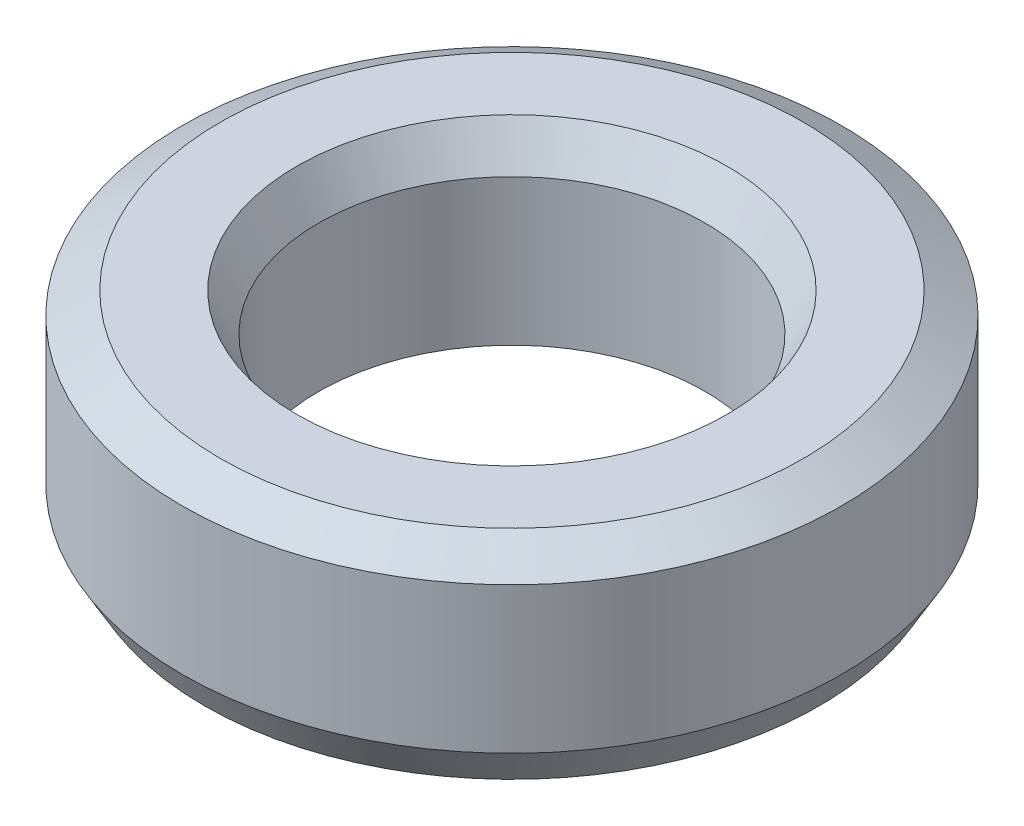
from build123d import *
from OCP.BRepFilletAPI import BRepFilletAPI_MakeChamfer

# Parameters (mm, degrees)
SKETCH1_R           = 55
BOSS_EXTRUDE1_DEPTH = 34.391737729
SKETCH2_R           = 32.224830731
CUT_EXTRUDE1_DEPTH  = 86.045820732
CHAMFER1_SIZE       = 3.67362785
CHAMFER1_SIZE2      = 6.362910084


with BuildPart() as part:
    # Sketch1 → Boss-Extrude1 (new body)
    with BuildSketch(Plane(origin=(0, 0, 0), x_dir=(1, 0, 0), z_dir=(0, 1, 0))):
        Circle(SKETCH1_R)
    extrude(amount=BOSS_EXTRUDE1_DEPTH)

    # Sketch2 → Cut-Extrude1 (cut, through all)
    with BuildSketch(Plane(origin=(0, 0, 0), x_dir=(1, 0, 0), z_dir=(0, 1, 0))):
        Circle(SKETCH2_R)
    extrude(amount=CUT_EXTRUDE1_DEPTH, mode=Mode.SUBTRACT)

    # Chamfer1: one chamfer whose edges measure the first distance from different faces: ONE call of the kernel's chamfer builder (chamfer() names one face for all edges)
    chamfer1_edges_1 = [part.edges().sort_by_distance(p)[0] for p in [
        (-32.224830731, 34.391737729, 0),
    ]]
    chamfer1_side_1 = [part.faces().sort_by_distance(p)[0] for p in [
        (-53.444365081, 34.391737729, 0),
    ]]
    chamfer1_edges_2 = [part.edges().sort_by_distance(p)[0] for p in [
        (-32.224830731, 0, 0),
    ]]
    chamfer1_side_2 = [part.faces().sort_by_distance(p)[0] for p in [
        (-32.224830731, 17.195868864, 0),
    ]]
    chamfer1_edges_3 = [part.edges().sort_by_distance(p)[0] for p in [
        (-55, 0, 0),
    ]]
    chamfer1_side_3 = [part.faces().sort_by_distance(p)[0] for p in [
        (-53.444365081, 0, 0),
    ]]
    chamfer1_edges_4 = [part.edges().sort_by_distance(p)[0] for p in [
        (-55, 34.391737729, 0),
    ]]
    chamfer1_side_4 = [part.faces().sort_by_distance(p)[0] for p in [
        (-55, 17.195868864, 0),
    ]]
    chamfer1 = BRepFilletAPI_MakeChamfer(part.part.solid().wrapped)
    for e in chamfer1_edges_1:
        chamfer1.Add(CHAMFER1_SIZE, CHAMFER1_SIZE2, e.wrapped, chamfer1_side_1[0].wrapped)  # the first distance lies on this face
    for e in chamfer1_edges_2:
        chamfer1.Add(CHAMFER1_SIZE, CHAMFER1_SIZE2, e.wrapped, chamfer1_side_2[0].wrapped)  # the first distance lies on this face
    for e in chamfer1_edges_3:
        chamfer1.Add(CHAMFER1_SIZE, CHAMFER1_SIZE2, e.wrapped, chamfer1_side_3[0].wrapped)  # the first distance lies on this face
    for e in chamfer1_edges_4:
        chamfer1.Add(CHAMFER1_SIZE, CHAMFER1_SIZE2, e.wrapped, chamfer1_side_4[0].wrapped)  # the first distance lies on this face
    add(Compound.cast(chamfer1.Shape()), mode=Mode.REPLACE)


solid = part.part
